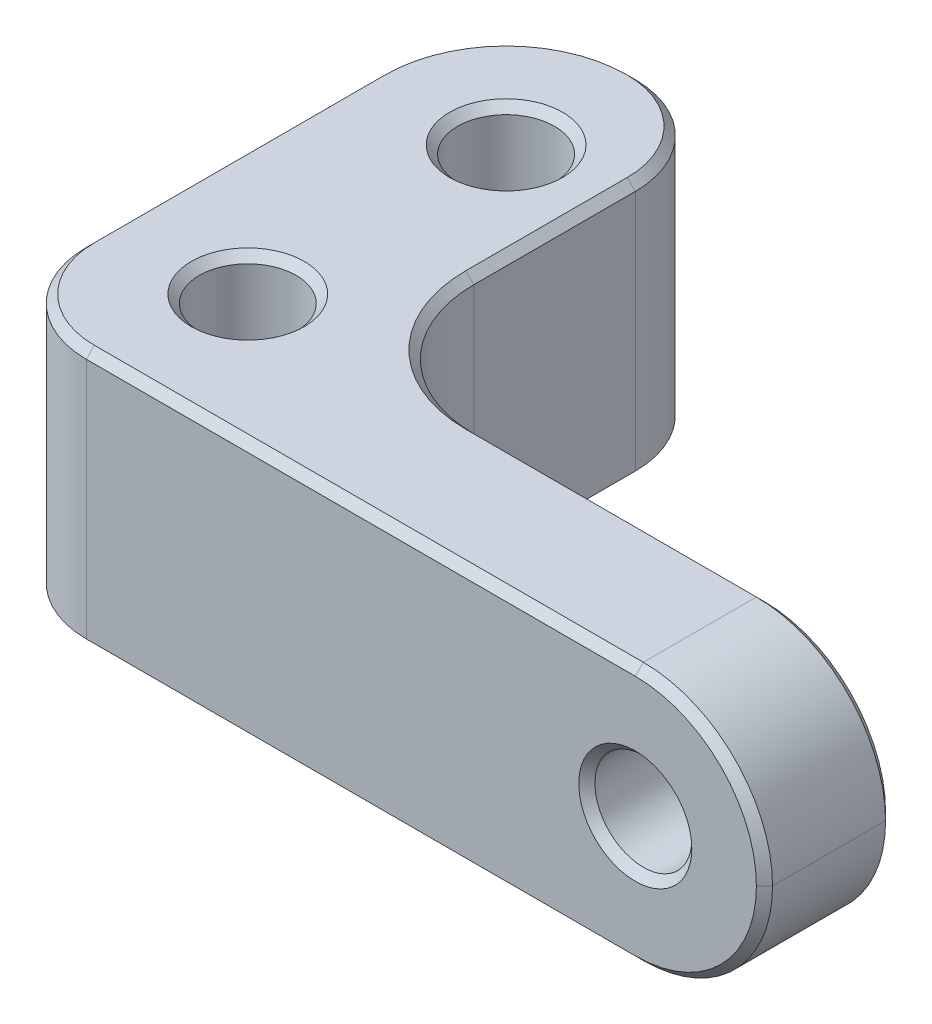
from build123d import *

# Parameters (mm, degrees)
SKETCH1_R               = 2.38125
BOSS_EXTRUDE1_DEPTH     = 6.35
CUT_EXTRUDE1_DEPTH      = 42.152703435
CUT_EXTRUDE1_DEPTH_BACK = 42.152703435
SKETCH2_R               = 2.38125
FILLET1_R               = 6.35
FILLET2_R               = 4.7625
CHAMFER1_SIZE           = 0.396875


with BuildPart() as part:
    # Sketch1 → Boss-Extrude1 (new, symmetric)
    with BuildSketch(Plane(origin=(0, 0, 0), x_dir=(1, 0, 0), z_dir=(0, 1, 0))):
        Polygon((-6.35, -6.35), (31.75, -6.35), (31.75, 0), (4.7625, 0), (4.7625, 19.05), (-6.35, 19.05), align=None)
        with Locations(Location((0, 0, 0), (0, 0, 270))):
            Circle(SKETCH1_R, mode=Mode.SUBTRACT)
        with Locations(Location((0, 12.7, 0), (0, 0, 270))):
            Circle(SKETCH1_R, mode=Mode.SUBTRACT)
    extrude(amount=BOSS_EXTRUDE1_DEPTH, both=True)

    # Sketch2 → Cut-Extrude1 (cut, two sides: drawn at the far end of the back side and taken through both)
    with BuildSketch(Plane.XY.offset(6.35).offset(-CUT_EXTRUDE1_DEPTH_BACK)):
        with Locations((25.4, 0)):
            Circle(SKETCH2_R)
    extrude(amount=CUT_EXTRUDE1_DEPTH + CUT_EXTRUDE1_DEPTH_BACK, mode=Mode.SUBTRACT)

    # Fillet1
    fillet1_edges = [part.edges().sort_by_distance(p)[0] for p in [
        (-6.35, 0, -19.05),
        (4.7625, 0, 0),
        (31.75, -6.35, 3.175),
        (31.75, 6.35, 3.175),
    ]]
    fillet(fillet1_edges, radius=FILLET1_R - 0.0001)  # a hair under: the kernel refuses the full size

    # Fillet2
    fillet2_edges = [part.edges().sort_by_distance(p)[0] for p in [
        (-6.35, 0, 6.35),
        (4.7625, 0, -19.05),
    ]]
    fillet(fillet2_edges, radius=FILLET2_R)

    # Chamfer1
    chamfer1_edges = [part.edges().sort_by_distance(p)[0] for p in [
        (0, -6.35, -2.38125),
        (0, 6.35, -2.38125),
        (0, -6.35, -15.08125),
        (0, 6.35, -15.08125),
        (23.01875, 0, 0),
        (23.01875, 0, 6.35),
        (-6.35, -6.35, -5.5563),
        (-6.35, 6.35, -5.5563),
        (4.7625, -6.35, -10.3187),
        (18.25625, -6.35, 0),
        (-4.49015735, -6.35, -17.19015735),
        (18.25625, 6.35, 0),
        (4.7625, 6.35, -10.3187),
        (-4.49015735, 6.35, -17.19015735),
        (29.89015735, 4.49015735, 0),
        (29.89015735, -4.49015735, 0),
        (29.89015735, 4.49015735, 6.35),
        (29.89015735, -4.49015735, 6.35),
        (6.62234265, -6.35, -1.85984265),
        (6.62234265, 6.35, -1.85984265),
        (11.9063, -6.35, 6.35),
        (11.9063, 6.35, 6.35),
        (3.367596045, -6.35, -17.655096045),
        (-4.955096045, -6.35, 4.955096045),
        (3.367596045, 6.35, -17.655096045),
        (-4.955096045, 6.35, 4.955096045),
    ]]
    chamfer(chamfer1_edges, length=CHAMFER1_SIZE)


solid = part.part
